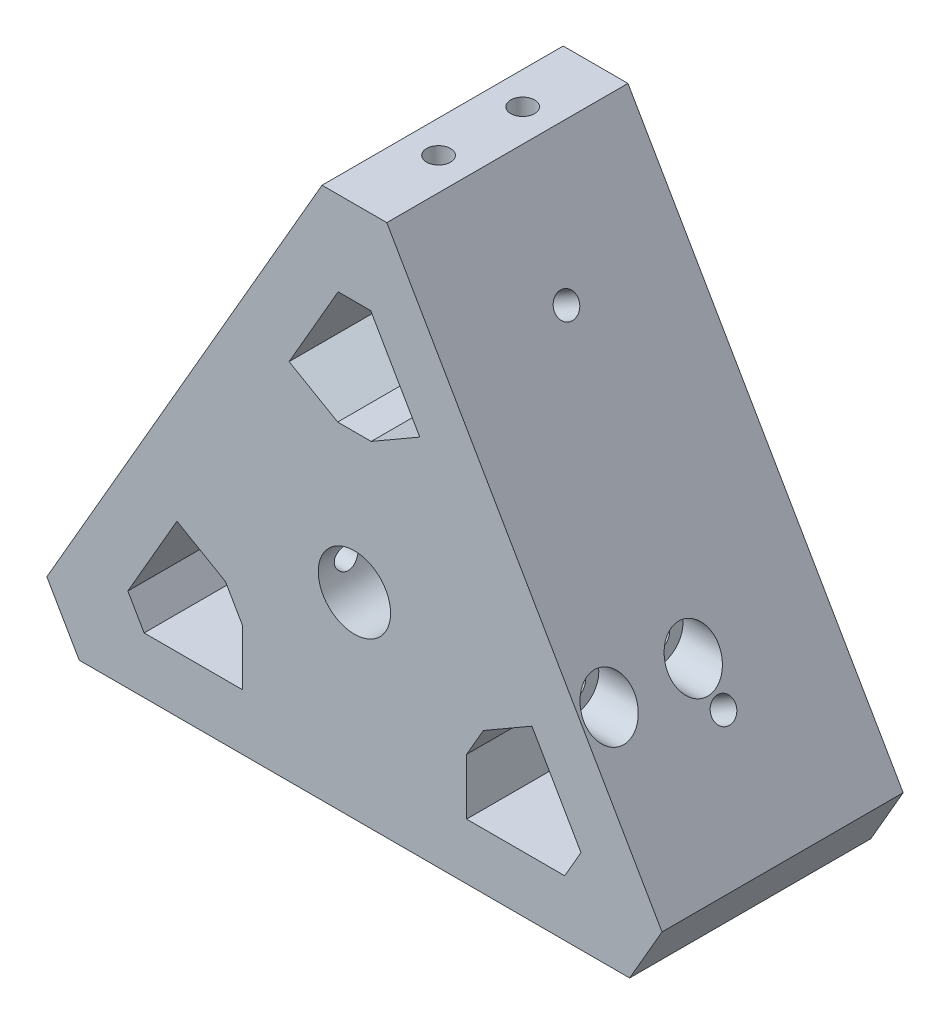
from build123d import *

# Parameters (mm, degrees)
SKETCH_1_R               = 6.45
EXTRUDE_1_DEPTH          = 43
CUT_EXTRUDE_3_DEPTH      = 92.963760979
SKETCH_3_R               = 2.125
CUT_EXTRUDE_4_DEPTH      = 15
PATTERN_CIRCULAR_1_COUNT = 3
SKETCH_4_R               = 2.125
CUT_EXTRUDE_5_DEPTH      = 118.823314048
SKETCH_6_R               = 2.15
CUT_EXTRUDE_7_DEPTH      = 128.471565491
SKETCH_7_R               = 4.5
CUT_EXTRUDE_8_DEPTH      = 15


with BuildPart() as part:
    # 草图1 → 凸台-拉伸1 (new body)
    with BuildSketch(Plane.XY):
        Polygon((5.773502692, 60), (-5.773502692, 60), (-54.848275573, -25), (-49.074772881, -35), (49.074772881, -35), (54.848275573, -25), align=None)
        Circle(SKETCH_1_R, mode=Mode.SUBTRACT)
    extrude(amount=EXTRUDE_1_DEPTH)

    # 草图2 → 切除-拉伸3 (cut, through all)
    with BuildSketch(Plane.XY.offset(43)):
        Polygon((2.900635095, 44.975952642), (-2.900635095, 44.975952642), (-11.650635095, 29.820508076), (-2.990381057, 24.820508076), (2.990381057, 24.820508076), (11.650635095, 29.820508076), align=None)
        Polygon((-22.990381057, -9.820508076), (-31.650635095, -4.820508076), (-40.400635095, -19.975952642), (-37.5, -25), (-20, -25), (-20, -15), align=None)
        Polygon((40.400635095, -19.975952642), (31.650635095, -4.820508076), (22.990381057, -9.820508076), (20, -15), (20, -25), (37.5, -25), align=None)
    extrude(amount=-CUT_EXTRUDE_3_DEPTH, mode=Mode.SUBTRACT)

    # 草图3 → 切除-拉伸4 (cut)
    with BuildSketch(Plane(origin=(-30.310889132, 17.5, 0), x_dir=(0, 0, 1), z_dir=(-0.8660254037844362, 0.5000000000000046, 0))):
        with Locations((21.5, 28)):
            Circle(SKETCH_3_R)
        with Locations((21.5, -28)):
            Circle(SKETCH_3_R)
    cut_extrude_4 = extrude(amount=-CUT_EXTRUDE_4_DEPTH, mode=Mode.SUBTRACT)

    # 阵列(圆周)1: 切除-拉伸4 ×3 about axis
    pattern_circular_1_axis = Axis((0, 0, 43), (0, 0, -1))
    for i in range(1, PATTERN_CIRCULAR_1_COUNT):
        add(cut_extrude_4.rotate(pattern_circular_1_axis, i * 360 / PATTERN_CIRCULAR_1_COUNT), mode=Mode.SUBTRACT)

    # 草图4 → 切除-拉伸5 (cut, through all)
    with BuildSketch(Plane.XZ.offset(35)):
        with Locations((0, 13)):
            Circle(SKETCH_4_R)
        with Locations((0, 28)):
            Circle(SKETCH_4_R)
    extrude(amount=-CUT_EXTRUDE_5_DEPTH, mode=Mode.SUBTRACT)

    # 草图6 → 切除-拉伸7 (cut, through all)
    with BuildSketch(Plane(origin=(49.074772881, 0, 0), x_dir=(0, 0, -1), z_dir=(-1, 0, 0))):
        with Locations((-23, 0)):
            Circle(SKETCH_6_R)
        with Locations((-38, 0)):
            Circle(SKETCH_6_R)
    extrude(amount=CUT_EXTRUDE_7_DEPTH, mode=Mode.SUBTRACT)

    # 草图7 → 切除-拉伸8 (cut)
    with BuildSketch(Plane(origin=(49.074772881, 0, 0), x_dir=(0, 0, -1), z_dir=(-1, 0, 0))):
        with Locations((-38, 0)):
            Circle(SKETCH_7_R)
        with Locations((-23, 0)):
            Circle(SKETCH_7_R)
    extrude(amount=CUT_EXTRUDE_8_DEPTH, mode=Mode.SUBTRACT)


solid = part.part
